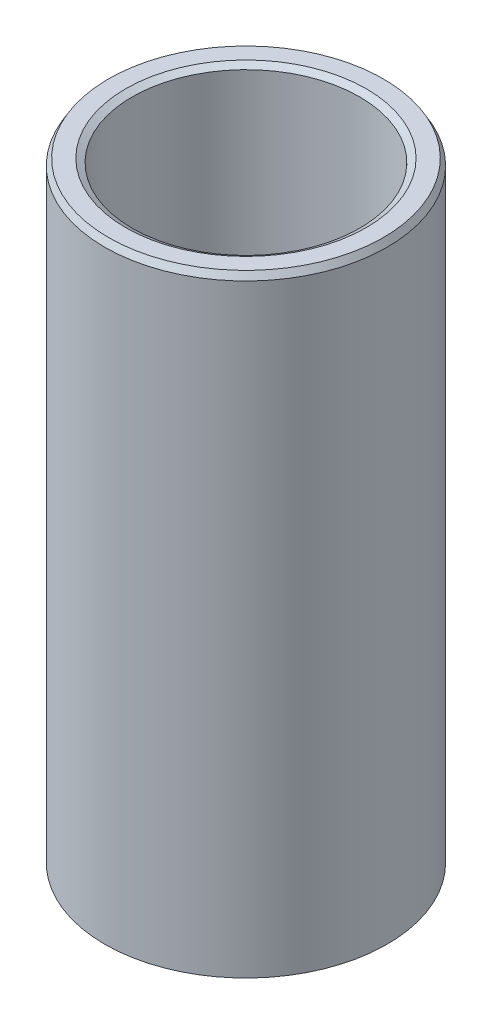
from build123d import *
from OCP.BRepFilletAPI import BRepFilletAPI_MakeChamfer

# Parameters (mm, degrees)
SKETCH1_R           = 45
BOSS_EXTRUDE1_DEPTH = 195.673046038
SKETCH2_R           = 36.264808612
CUT_EXTRUDE1_DEPTH  = 206.761854934
CHAMFER1_SIZE       = 2.078633117
CHAMFER1_SIZE2      = 1.20009939


with BuildPart() as part:
    # Sketch1 → Boss-Extrude1 (new body)
    with BuildSketch(Plane(origin=(0, 0, 0), x_dir=(1, 0, 0), z_dir=(0, 1, 0))):
        Circle(SKETCH1_R)
    extrude(amount=BOSS_EXTRUDE1_DEPTH)

    # Sketch2 → Cut-Extrude1 (cut, through all)
    with BuildSketch(Plane(origin=(0, 0, 0), x_dir=(1, 0, 0), z_dir=(0, 1, 0))):
        Circle(SKETCH2_R)
    extrude(amount=CUT_EXTRUDE1_DEPTH, mode=Mode.SUBTRACT)

    # Chamfer1: one chamfer whose edges measure the first distance from different faces: ONE call of the kernel's chamfer builder (chamfer() names one face for all edges)
    chamfer1_edges_1 = [part.edges().sort_by_distance(p)[0] for p in [
        (-36.264808612, 195.673046038, 0),
    ]]
    chamfer1_side_1 = [part.faces().sort_by_distance(p)[0] for p in [
        (-43.727207794, 195.673046038, 0),
    ]]
    chamfer1_edges_2 = [part.edges().sort_by_distance(p)[0] for p in [
        (-36.264808612, 0, 0),
    ]]
    chamfer1_side_2 = [part.faces().sort_by_distance(p)[0] for p in [
        (-36.264808612, 97.836523019, 0),
    ]]
    chamfer1_edges_3 = [part.edges().sort_by_distance(p)[0] for p in [
        (-45, 0, 0),
    ]]
    chamfer1_side_3 = [part.faces().sort_by_distance(p)[0] for p in [
        (-43.727207794, 0, 0),
    ]]
    chamfer1_edges_4 = [part.edges().sort_by_distance(p)[0] for p in [
        (-45, 195.673046038, 0),
    ]]
    chamfer1_side_4 = [part.faces().sort_by_distance(p)[0] for p in [
        (-45, 97.836523019, 0),
    ]]
    chamfer1 = BRepFilletAPI_MakeChamfer(part.part.solid().wrapped)
    for e in chamfer1_edges_1:
        chamfer1.Add(CHAMFER1_SIZE, CHAMFER1_SIZE2, e.wrapped, chamfer1_side_1[0].wrapped)  # the first distance lies on this face
    for e in chamfer1_edges_2:
        chamfer1.Add(CHAMFER1_SIZE, CHAMFER1_SIZE2, e.wrapped, chamfer1_side_2[0].wrapped)  # the first distance lies on this face
    for e in chamfer1_edges_3:
        chamfer1.Add(CHAMFER1_SIZE, CHAMFER1_SIZE2, e.wrapped, chamfer1_side_3[0].wrapped)  # the first distance lies on this face
    for e in chamfer1_edges_4:
        chamfer1.Add(CHAMFER1_SIZE, CHAMFER1_SIZE2, e.wrapped, chamfer1_side_4[0].wrapped)  # the first distance lies on this face
    add(Compound.cast(chamfer1.Shape()), mode=Mode.REPLACE)


solid = part.part
